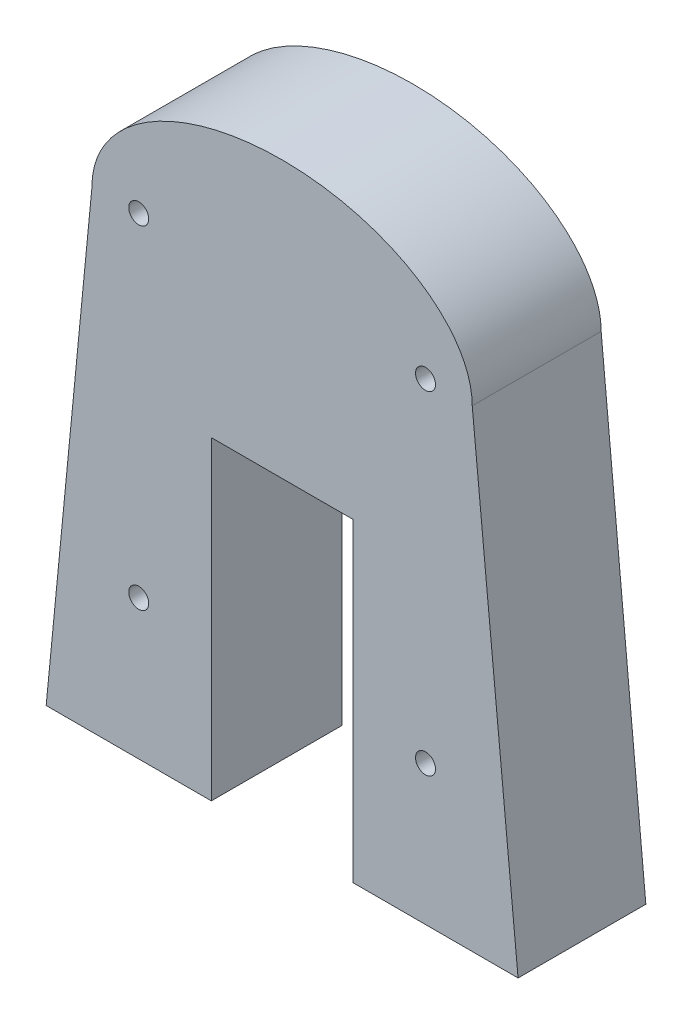
from build123d import *

# Parameters (mm, degrees)
BOSS_EXTRUDE1_DEPTH              = 10
CUT_EXTRUDE_TRACKWALLCURVE_DEPTH = 71.987340569
CUT_EXTRUDE4_START               = -25.4
SKETCH11_R                       = 0.762
CUT_EXTRUDE4_DEPTH               = 32.4


with BuildPart() as part:
    # Sketch3 → Boss-Extrude1 (new body)
    with BuildSketch(Plane.XY):
        with BuildLine():
            Line((0.498405995, 53.05), (-3, 17))
            Line((-3, 17), (9.6, 17))
            Line((9.6, 17), (9.6, 41))
            Line((9.6, 41), (20.4, 41))
            Line((20.4, 41), (20.4, 17))
            Line((20.4, 17), (33, 17))
            Line((33, 17), (29.501594005, 53.05))
            add(Edge.make_bspline(
                [(29.501594005, 53.05), (29.501594005, 62.05), (15, 62.05), (0.498405995, 62.05), (0.498405995, 53.05)],
                knots=[3.141592654, 3.141592654, 3.141592654, 4.71238898, 4.71238898, 6.283185307, 6.283185307, 6.283185307], degree=2, weights=[1, 0.707106781, 1, 0.707106781, 1]))
        make_face()
    extrude(amount=BOSS_EXTRUDE1_DEPTH)

    # Sketch10 → Cut-Extrude-TrackWallCurve (cut, through all)
    with BuildSketch(Plane(origin=(0, 0, 0), x_dir=(1, 0, 0), z_dir=(0, 1, 0))):
        with BuildLine():
            Line((-22.389187746, 76.808429662), (-18.31810455, -0.872465273))
            ThreePointArc((-18.31810455, -0.872465273), (-1.664762144, -0.218153677), (15.000001459, 0))
            ThreePointArc((15.000001459, 0), (31.664763602, -0.218153715), (48.31810455, -0.872465273))
            Line((48.31810455, -0.872465273), (52.389187746, 76.808429662))
            ThreePointArc((52.389187746, 76.808429662), (27.468127249, 77.678692292), (2.53187626, 77.678692353))
            ThreePointArc((2.53187626, 77.678692353), (-9.932453077, 77.352302433), (-22.389187746, 76.808429662))
        make_face()
    extrude(amount=CUT_EXTRUDE_TRACKWALLCURVE_DEPTH, mode=Mode.SUBTRACT)

    # Sketch11 → Cut-Extrude4 (cut)
    with BuildSketch(Plane(origin=(3.889452987, 0, 0.096960275), x_dir=(-0.9998476951563915, 0, 0.0174524064372769), z_dir=(-0.0174524064372769, 0, -0.9998476951563915)).offset(CUT_EXTRUDE4_START)):
        with Locations((0, 53.05)):
            Circle(SKETCH11_R)
        with Locations((0, 27.65)):
            Circle(SKETCH11_R)
    cut_extrude4 = extrude(amount=CUT_EXTRUDE4_DEPTH, mode=Mode.SUBTRACT)

    # Mirror2: Cut-Extrude4 across plane
    add(cut_extrude4.mirror(Plane(origin=(15, 0, 0), x_dir=(0, 0, 1), z_dir=(1, 0, 0))), mode=Mode.SUBTRACT)


solid = part.part
